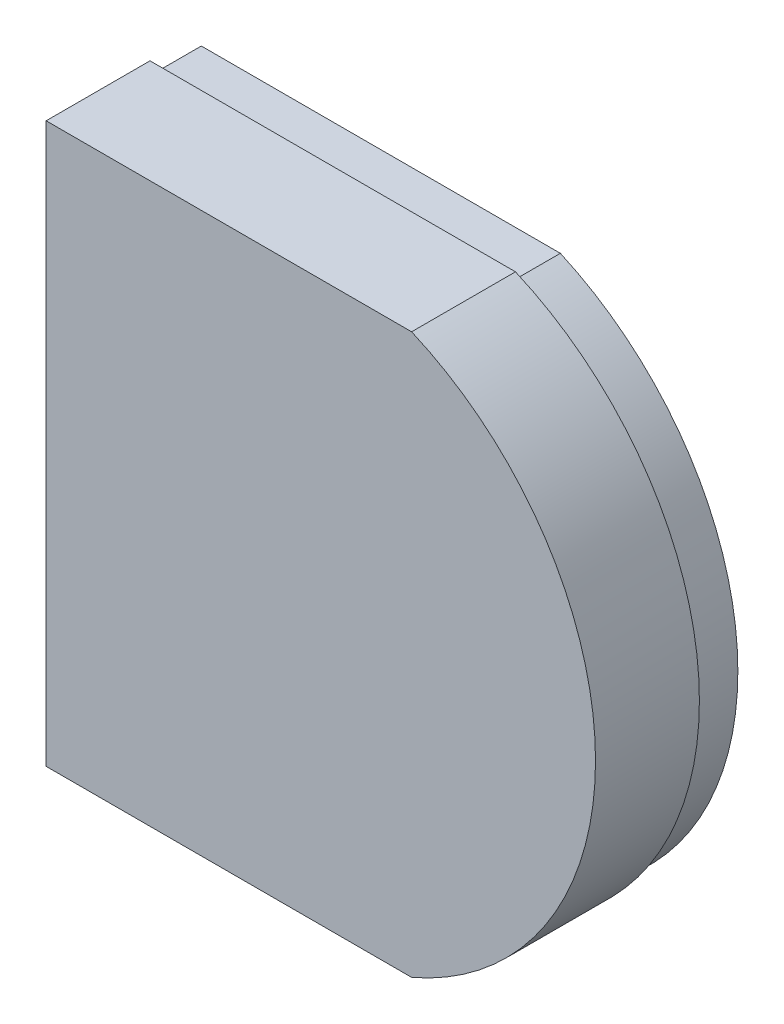
from build123d import *

# Parameters (mm, degrees)
SKETCH1_W                = 25
SKETCH1_H                = 40
BOSS_EXTRUDE1_DEPTH      = 8
BOSS_EXTRUDE5_DEPTH      = 10.6
BOSS_EXTRUDE5_DEPTH_BACK = 1
CUT_EXTRUDE2_DEPTH       = 9
CUT_EXTRUDE2_DEPTH_BACK  = 6
CUT_EXTRUDE3_DEPTH       = 3.5


with BuildPart() as part:
    # Sketch1 → Boss-Extrude1 (new body)
    with BuildSketch(Plane.XY):
        with Locations((-61.729654626, 25.727532329)):
            Rectangle(SKETCH1_W, SKETCH1_H)
    extrude(amount=BOSS_EXTRUDE1_DEPTH)

    # Sketch2 → Boss-Extrude5 (add, two sides: drawn at the far end of the back side and taken through both)
    with BuildSketch(Plane.XY.offset(-BOSS_EXTRUDE5_DEPTH_BACK)):
        with BuildLine():
            Line((-49.388759409, 47.527532329), (-77.888759409, 47.527532329))
            Line((-77.888759409, 47.527532329), (-77.888759409, 3.927532329))
            Line((-77.888759409, 3.927532329), (-49.388759409, 3.927532329))
            ThreePointArc((-49.388759409, 3.927532329), (-35.047275566, 25.727532329), (-49.388759409, 47.527532329))
        make_face()
    extrude(amount=BOSS_EXTRUDE5_DEPTH + BOSS_EXTRUDE5_DEPTH_BACK)

    # Sketch8 → Cut-Extrude2 (cut, two sides: drawn at the far end of the back side and taken through both)
    with BuildSketch(Plane.XY.offset(-CUT_EXTRUDE2_DEPTH_BACK)):
        with BuildLine():
            Line((-76.888759409, 46.527532329), (-76.888759409, 4.927532329))
            Line((-76.888759409, 4.927532329), (-49.388759409, 4.927532329))
            ThreePointArc((-49.388759409, 4.927532329), (-36.047275566, 25.727532329), (-49.388759409, 46.527532329))
            Line((-49.388759409, 46.527532329), (-76.888759409, 46.527532329))
        make_face()
    extrude(amount=CUT_EXTRUDE2_DEPTH + CUT_EXTRUDE2_DEPTH_BACK, mode=Mode.SUBTRACT)

    # Sketch11 → Cut-Extrude3 (cut)
    with BuildSketch(Plane(origin=(0, 0, -1), x_dir=(-1, 0, 0), z_dir=(0, 0, -1))):
        with BuildLine():
            Line((49.388759409, 47.527532329), (77.888759409, 47.527532329))
            Line((77.888759409, 47.527532329), (77.888759409, 3.927532329))
            Line((77.888759409, 3.927532329), (49.388759409, 3.927532329))
            ThreePointArc((49.388759409, 3.927532329), (35.047275566, 25.727532329), (49.388759409, 47.527532329))
        make_face()
        with BuildLine():
            Line((49.388759409, 4.427532329), (77.388759409, 4.427532329))
            Line((77.388759409, 4.427532329), (77.388759409, 47.027532329))
            Line((77.388759409, 47.027532329), (49.388759409, 47.027532329))
            ThreePointArc((49.388759409, 47.027532329), (35.547275566, 25.727532329), (49.388759409, 4.427532329))
        make_face(mode=Mode.SUBTRACT)
    extrude(amount=-CUT_EXTRUDE3_DEPTH, mode=Mode.SUBTRACT)


solid = part.part
